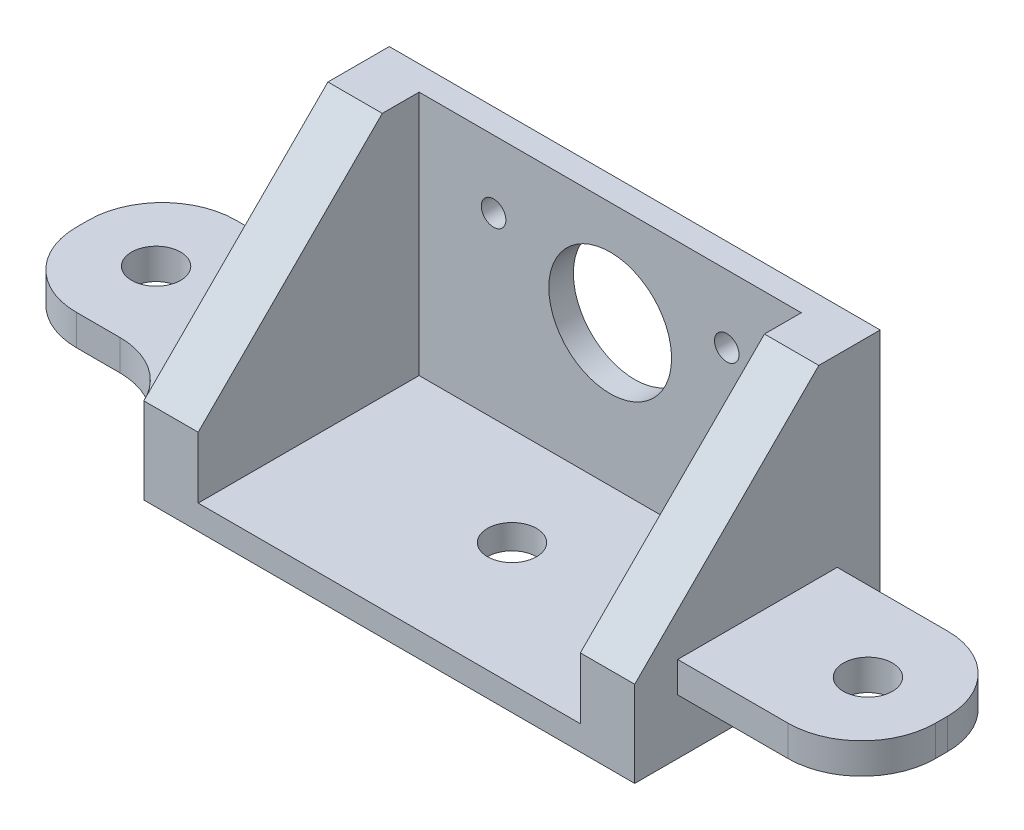
from build123d import *

# Parameters (mm, degrees)
SKETCH1_W           = 40
SKETCH1_H           = 20
BOSS_EXTRUDE1_DEPTH = 2
SKETCH2_W           = 40
SKETCH2_H           = 2
BOSS_EXTRUDE2_DEPTH = 20
SKETCH4_R           = 5
SKETCH4_R_2         = 1
CUT_EXTRUDE2_DEPTH  = 36.832945734
SKETCH5_R           = 2
CUT_EXTRUDE3_DEPTH  = 32.368774283
SKETCH6_W           = 4.431073847
SKETCH6_H           = 18
BOSS_EXTRUDE3_DEPTH = 20
CHAMFER1_SIZE       = 15
SKETCH7_W           = 13
SKETCH7_H           = 2.5
BOSS_EXTRUDE4_DEPTH = 15
FILLET1_R           = 6
SKETCH8_R           = 2
CUT_EXTRUDE4_DEPTH  = 40.37003937
MIRROR1_START       = 4.5
MIRROR1_OUTLINE_R   = 2
MIRROR1_DEPTH       = 2.5
MIRROR1_START_2     = 2
MIRROR1_2_OUTLINE_W = 4.431073847
MIRROR1_2_OUTLINE_H = 18
MIRROR1_2_DEPTH     = 2.5
MIRROR1_START_3     = 15.568926153
MIRROR1_3_DEPTH     = 4.431073847


with BuildPart() as part:
    # Sketch1 → Boss-Extrude1 (new body)
    with BuildSketch(Plane(origin=(0, 0, 0), x_dir=(1, 0, 0), z_dir=(0, 1, 0))):
        Rectangle(SKETCH1_W, SKETCH1_H)
    extrude(amount=BOSS_EXTRUDE1_DEPTH)

    # Sketch2 → Boss-Extrude2 (add)
    with BuildSketch(Plane(origin=(0, 2, 0), x_dir=(1, 0, 0), z_dir=(0, 1, 0))):
        with Locations((0, 9)):
            Rectangle(SKETCH2_W, SKETCH2_H)
    extrude(amount=BOSS_EXTRUDE2_DEPTH)

    # Sketch4 → Cut-Extrude2 (cut, through all)
    with BuildSketch(Plane(origin=(0, 0, -10), x_dir=(-1, 0, 0), z_dir=(0, 0, -1))):
        with Locations((0, 13.5)):
            Circle(SKETCH4_R)
        with Locations((-9.5, 16.5)):
            Circle(SKETCH4_R_2)
        with Locations((9.5, 16.5)):
            Circle(SKETCH4_R_2)
    extrude(amount=-CUT_EXTRUDE2_DEPTH, mode=Mode.SUBTRACT)

    # Sketch5 → Cut-Extrude3 (cut, through all)
    with BuildSketch(Plane.XZ):
        with Locations(Location((0, 0, 0), (0, 0, 270))):
            Circle(SKETCH5_R)
    extrude(amount=-CUT_EXTRUDE3_DEPTH, mode=Mode.SUBTRACT)

    # Sketch6 → Boss-Extrude3 (add)
    with BuildSketch(Plane(origin=(0, 2, 0), x_dir=(1, 0, 0), z_dir=(0, 1, 0))):
        with Locations((-17.784463076, -1)):
            Rectangle(SKETCH6_W, SKETCH6_H)
    extrude(amount=BOSS_EXTRUDE3_DEPTH)

    # Chamfer1
    chamfer1_edges = [part.edges().sort_by_distance(p)[0] for p in [
        (-17.784463077, 22, 10),
    ]]
    chamfer(chamfer1_edges, length=CHAMFER1_SIZE)

    # Sketch7 → Boss-Extrude4 (add)
    with BuildSketch(Plane.ZY.offset(20)):
        with Locations((0, 5.75)):
            Rectangle(SKETCH7_W, SKETCH7_H)
    extrude(amount=BOSS_EXTRUDE4_DEPTH)

    # Fillet1
    # the kernel refuses this fillet: 6 mm, written as the material it adds along each edge
    with BuildSketch(Plane(origin=(-20, 4.5, 6.5), x_dir=(0, 0, 1), z_dir=(0, 1, 0)), Plane(origin=(-20, 7, -6.5), x_dir=(0, 0, -1), z_dir=(0, -1, 0))) as fillet1_piece_1:
        with BuildLine():
            CenterArc((6, -5.454356057), FILLET1_R, 114.624318352, 65.375681648)
            Line((0, -5.454356057), (0, 0))
            Line((0, 0), (3.5, 0))
        make_face()
    extrude(amount=2.5)
    # the kernel refuses this fillet: 6 mm, written as the material it takes off along each edge
    with BuildSketch(Plane(origin=(-35, -10.5, 6.5), x_dir=(1, 0, 0), z_dir=(0, 1, 0))) as fillet1_2_piece_1:
        with BuildLine():
            CenterArc((FILLET1_R, FILLET1_R), FILLET1_R, 180, 90)
            Line((0, FILLET1_R), (0, 0))
            Line((0, 0), (FILLET1_R, 0))
        make_face()
    extrude(amount=32.5, mode=Mode.SUBTRACT)
    with BuildSketch(Plane(origin=(-35, 22, -6.5), x_dir=(0, 0, 1), z_dir=(0, -1, 0))) as fillet1_2_piece_2:
        with BuildLine():
            CenterArc((FILLET1_R, -FILLET1_R), FILLET1_R, 90, 90)
            Line((0, -FILLET1_R), (0, 0))
            Line((0, 0), (FILLET1_R, 0))
        make_face()
    extrude(amount=32.5, mode=Mode.SUBTRACT)

    # Sketch8 → Cut-Extrude4 (cut, through all)
    with BuildSketch(Plane(origin=(0, 7, 0), x_dir=(1, 0, 0), z_dir=(0, 1, 0))):
        with Locations(Location((-29, 0, 0), (0, 0, 270))):
            Circle(SKETCH8_R)
    extrude(amount=-CUT_EXTRUDE4_DEPTH, mode=Mode.SUBTRACT)

    # Mirror1: read off the stored shape, not the designer's step
    # Mirror1 outline → Mirror1 (add)
    with BuildSketch(Plane(origin=(0, 0, 0), x_dir=(1, 0, 0), z_dir=(0, 1, 0)).offset(MIRROR1_START)):
        with BuildLine():
            Line((20, 6.5), (20, 8))
            Line((20, 8), (15.568926153, 8))
            Line((15.568926153, 8), (15.568926153, -10))
            Line((15.568926153, -10), (20, -10))
            Line((20, -10), (20, -6.5))
            Line((20, -6.5), (29, -6.5))
            ThreePointArc((29, -6.5), (33.242640687, -4.742640687), (35, -0.5))
            Line((35, -0.5), (35, 0.5))
            ThreePointArc((35, 0.5), (33.242640687, 4.742640687), (29, 6.5))
            Line((29, 6.5), (20, 6.5))
        make_face()
        with Locations((29, 0)):
            Circle(MIRROR1_OUTLINE_R, mode=Mode.SUBTRACT)
    extrude(amount=MIRROR1_DEPTH)

    # Mirror1 2 outline → Mirror1 2 (add)
    with BuildSketch(Plane(origin=(0, 0, 0), x_dir=(1, 0, 0), z_dir=(0, 1, 0)).offset(MIRROR1_START_2)):
        with Locations((17.784463076, -1)):
            Rectangle(MIRROR1_2_OUTLINE_W, MIRROR1_2_OUTLINE_H)
    extrude(amount=MIRROR1_2_DEPTH)

    # Mirror1 3 outline → Mirror1 3 (add)
    with BuildSketch(Plane.YZ.offset(MIRROR1_START_3)):
        Polygon((7, -8), (22, -8), (22, -5), (7, 10), align=None)
    extrude(amount=MIRROR1_3_DEPTH)


solid = part.part
